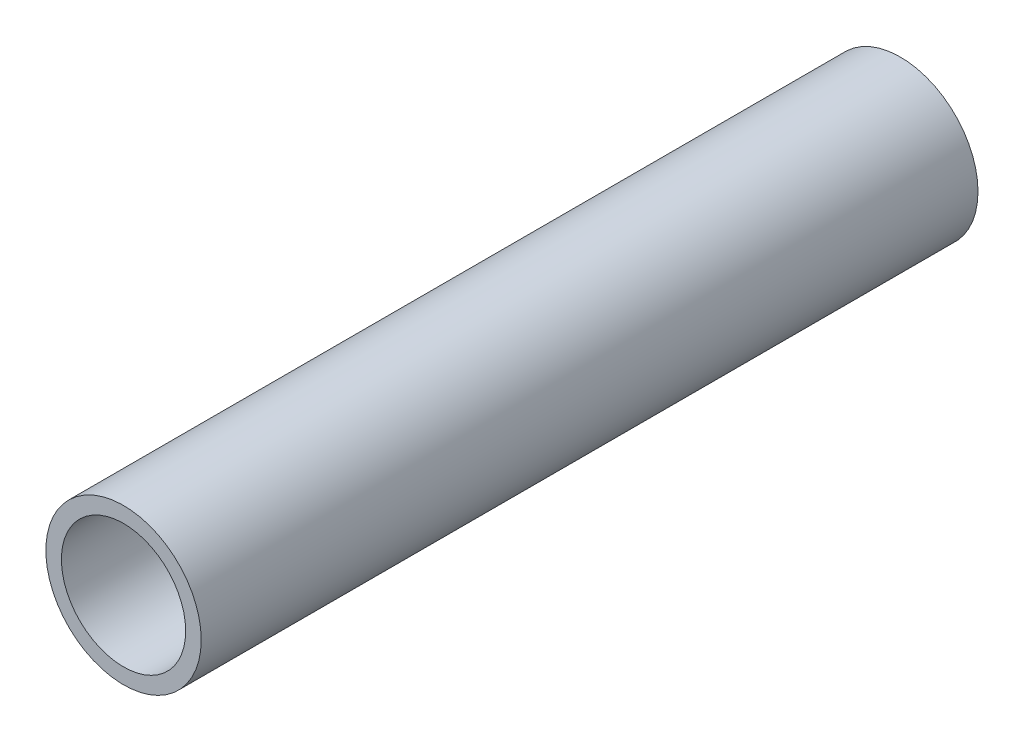
from build123d import *

# Parameters (mm, degrees)
SKETCH1_R           = 10
SKETCH1_R_2         = 8
BOSS_EXTRUDE1_DEPTH = 100


with BuildPart() as part:
    # Sketch1 → Boss-Extrude1 (new body)
    with BuildSketch(Plane.XY):
        Circle(SKETCH1_R)
        Circle(SKETCH1_R_2, mode=Mode.SUBTRACT)
    extrude(amount=BOSS_EXTRUDE1_DEPTH)


solid = part.part
